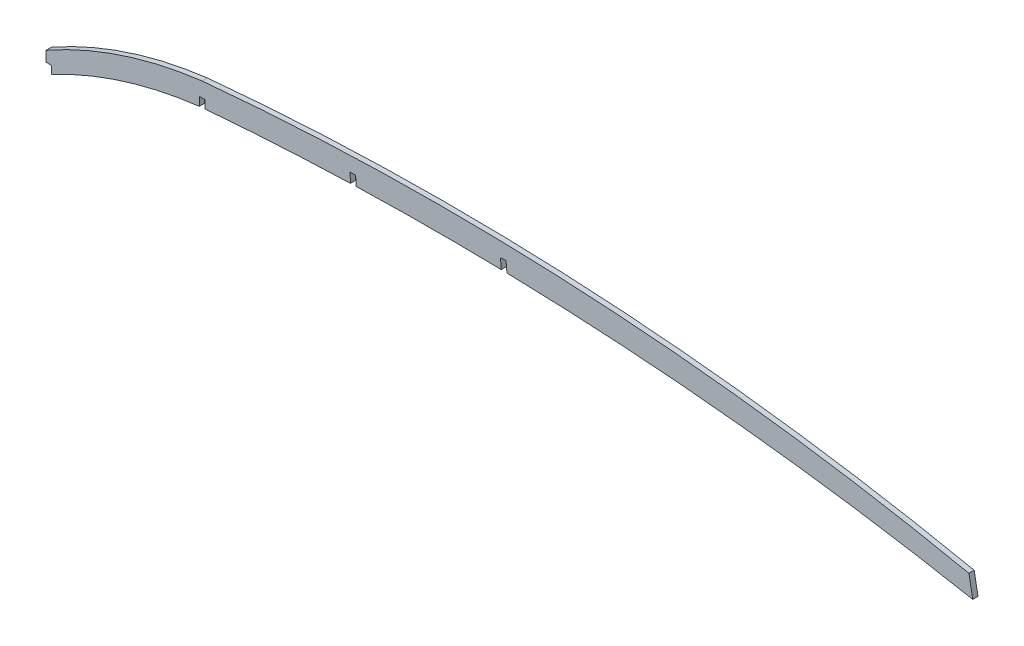
from build123d import *

# Parameters (mm, degrees)
BOSS_EXTRUDE1_DEPTH = 3.175
SKETCH2_W           = 3.3528
SKETCH2_H           = 6.477
SKETCH2_W_2         = 3.3782
SKETCH2_H_2         = 12.7
CUT_EXTRUDE1_DEPTH  = 577.346072705


with BuildPart() as part:
    # Sketch1 → Boss-Extrude1 (new body)
    with BuildSketch(Plane.XY):
        with BuildLine():
            Line((557.916984218, 99.326538403), (555.638244479, 111.822940833))
            ThreePointArc((555.638244479, 111.822940833), (325.782502236, 142.132503557), (93.98, 137.668))
            ThreePointArc((93.98, 137.668), (45.466310815, 126.795024577), (0, 106.68))
            Line((0, 106.68), (0, 93.98))
            ThreePointArc((0, 93.98), (45.52945751, 113.491169294), (93.98, 123.794671649))
            ThreePointArc((93.98, 123.794671649), (326.784483289, 127.411721364), (557.916984218, 99.326538403))
        make_face()
    extrude(amount=BOSS_EXTRUDE1_DEPTH)

    # Sketch2 → Cut-Extrude1 (cut, through all)
    with BuildSketch(Plane.XY.offset(3.175)):
        with Locations((1.6764, 97.2185)):
            Rectangle(SKETCH2_W, SKETCH2_H)
        with Locations((93.98, 122.498746884)):
            Rectangle(SKETCH2_W_2, SKETCH2_H_2)
        Polygon((183.054551015, 134.687145422), (186.429805755, 134.828179757), (186.960010022, 122.139252165), (183.584755283, 121.99821783), align=None)
        Polygon((298.533171127, -116.284523632), (299.081273341, -122.651898671), (295.917971315, -122.924194999), (295.369869101, -116.55681996), align=None)
        Polygon((273.590830142, 135.268456112), (276.956583497, 135.558179406), (278.045768811, 122.904971301), (274.680015455, 122.615248007), align=None)
    extrude(amount=-CUT_EXTRUDE1_DEPTH, mode=Mode.SUBTRACT)


solid = part.part
